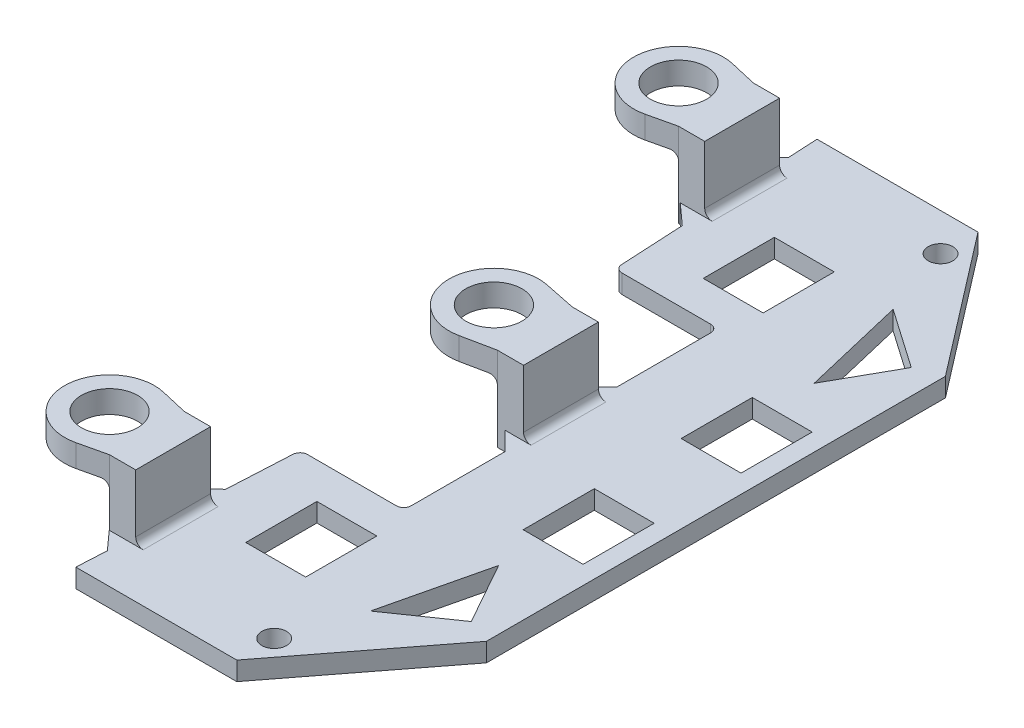
from build123d import *

# Parameters (mm, degrees)
RESSALTO_EXTRUS_O1_DEPTH = 1.25
ESBO_O8_R                = 1.65
ESBO_O8_W                = 8
ESBO_O8_H                = 9.5
CORTE_EXTRUS_O6_DEPTH    = 56.876112964
CORTE_EXTRUS_O5_DEPTH    = 10
RESSALTO_EXTRUS_O4_START = -1.25
ESBO_O12_W               = 3.5
ESBO_O12_H               = 10
RESSALTO_EXTRUS_O4_DEPTH = 11.25
ESBO_O13_R               = 3.75
RESSALTO_EXTRUS_O5_DEPTH = 3
RESSALTO_EXTRUS_O6_START = -11.25
ESBO_O14_W               = 3.5
ESBO_O14_H               = 10
RESSALTO_EXTRUS_O6_DEPTH = 11.25
ESBO_O15_R               = 3.75
RESSALTO_EXTRUS_O7_DEPTH = 3
CHANFRO1_SIZE            = 2.5
CHANFRO1_SIZE_2          = 2.378287199
CHANFRO1_SIZE_3          = 2.642541332
FILETE1_R                = 1


with BuildPart() as part:
    # Esboço1 → Ressalto-extrusão1 (new, symmetric)
    with BuildSketch(Plane(origin=(0, 0, 0), x_dir=(1, 0, 0), z_dir=(0, 1, 0))):
        Polygon((-10.5, -21), (-10.5, 21), (-24.3, 21), (-25.8, 49.5), (-4.3, 49.5), (10.2, 30.65), (10.2, -30.65), (-4.3, -49.5), (-25.8, -49.5), (-24.3, -21), align=None)
    extrude(amount=RESSALTO_EXTRUS_O1_DEPTH, both=True)

    # Esboço8 → Corte-extrusão6 (cut, through all)
    with BuildSketch(Plane(origin=(0, 1.25, 0), x_dir=(1, 0, 0), z_dir=(0, 1, 0))):
        with Locations(Location((-4.3, 44.5, 0), (0, 0, 270))):
            Circle(ESBO_O8_R)
        with Locations((-13.3, 30.55)):
            Rectangle(ESBO_O8_W, ESBO_O8_H)
        with Locations((3.75, 10.55)):
            Rectangle(ESBO_O8_W, ESBO_O8_H)
    corte_extrus_o6 = extrude(amount=-CORTE_EXTRUS_O6_DEPTH, mode=Mode.SUBTRACT)

    # Esboço9 → Corte-extrusão5 (cut)
    with BuildSketch(Plane(origin=(0, 1.25, 0), x_dir=(1, 0, 0), z_dir=(0, 1, 0))):
        Polygon((6.901537023, 29.384909169), (-1.046130524, 34.9078029), (2.24312, 21.07143213), align=None)
    corte_extrus_o5 = extrude(amount=-CORTE_EXTRUS_O5_DEPTH, mode=Mode.SUBTRACT)

    # Esboço12 → Ressalto-extrusão4 (add)
    with BuildSketch(Plane(origin=(0, 0, 0), x_dir=(1, 0, 0), z_dir=(0, 1, 0)).offset(RESSALTO_EXTRUS_O4_START)):
        with Locations((-26.05, 38)):
            Rectangle(ESBO_O12_W, ESBO_O12_H)
    ressalto_extrus_o4 = extrude(amount=RESSALTO_EXTRUS_O4_DEPTH)

    # Esboço13 → Ressalto-extrusão5 (add)
    with BuildSketch(Plane(origin=(0, 10, 0), x_dir=(1, 0, 0), z_dir=(0, 1, 0))):
        with BuildLine():
            Line((-31.444994432, 43.844994432), (-27.8, 43))
            Line((-27.8, 43), (-27.8, 33))
            Line((-27.8, 33), (-31.444994432, 32.155005568))
            ThreePointArc((-31.444994432, 32.155005568), (-38.8, 38), (-31.444994432, 43.844994432))
        make_face()
        with Locations(Location((-32.8, 38, 0), (0, 0, 270))):
            Circle(ESBO_O13_R, mode=Mode.SUBTRACT)
    ressalto_extrus_o5 = extrude(amount=-RESSALTO_EXTRUS_O5_DEPTH)

    # Espelhar1: Corte-extrusão6, Corte-extrusão5, Ressalto-extrusão4, Ressalto-extrusão5 across plane
    add(corte_extrus_o6.mirror(Plane.XY), mode=Mode.SUBTRACT)
    add(corte_extrus_o5.mirror(Plane.XY), mode=Mode.SUBTRACT)
    add(ressalto_extrus_o4.mirror(Plane.XY))
    add(ressalto_extrus_o5.mirror(Plane.XY))

    # Esboço14 → Ressalto-extrusão6 (add)
    with BuildSketch(Plane.XZ.offset(1.25).offset(RESSALTO_EXTRUS_O6_START)):
        with Locations((-12.25, 0)):
            Rectangle(ESBO_O14_W, ESBO_O14_H)
    extrude(amount=RESSALTO_EXTRUS_O6_DEPTH)

    # Esboço15 → Ressalto-extrusão7 (add)
    with BuildSketch(Plane(origin=(0, 10, 0), x_dir=(1, 0, 0), z_dir=(0, 1, 0))):
        with BuildLine():
            Line((-18.247793537, 5.876270543), (-14, 5))
            Line((-14, 5), (-14, -5))
            Line((-14, -5), (-18.247793537, -5.876270543))
            ThreePointArc((-18.247793537, -5.876270543), (-25.46, 0), (-18.247793537, 5.876270543))
        make_face()
        with Locations(Location((-19.46, 0, 0), (0, 0, 270))):
            Circle(ESBO_O15_R, mode=Mode.SUBTRACT)
    extrude(amount=-RESSALTO_EXTRUS_O7_DEPTH)

    # Chanfro1
    # the kernel refuses this chamfer: 2.642541332, 2.5, 2.378287199 mm, written as the material it adds along each edge
    with BuildSketch(Plane(origin=(-10.5, 1.25, -5), x_dir=(0.02749587661058631, 0, -0.9996219169112968), z_dir=(0, -1, 0))) as chanfro1_piece_1:
        Polygon((CHANFRO1_SIZE * 0.999621916911, -CHANFRO1_SIZE * 0.0274958766106), (-CHANFRO1_SIZE * 0.0274958766106, -CHANFRO1_SIZE * 0.999621916911), (0, 0), align=None)
    extrude(amount=2.5)
    with BuildSketch(Plane(origin=(-10.5, 1.25, 5), x_dir=(0.02749587661058631, 0, 0.9996219169112968), z_dir=(0, -1, 0))) as chanfro1_piece_2:
        Polygon((CHANFRO1_SIZE * 0.999621916911, CHANFRO1_SIZE * 0.0274958766106), (-CHANFRO1_SIZE * 0.0274958766106, CHANFRO1_SIZE * 0.999621916911), (0, 0), align=None)
    extrude(amount=2.5)
    with BuildSketch(Plane(origin=(-25.457894737, 1.25, 43), x_dir=(-0.9995382917887814, 0, -0.03038425987192659), z_dir=(0, -1, 0))) as chanfro1_piece_3_section:
        Polygon((CHANFRO1_SIZE_2 * 0.999538291707, -CHANFRO1_SIZE_2 * 0.0303842598694), (CHANFRO1_SIZE * 0.0221923026388, -CHANFRO1_SIZE * 0.999753720525), (0, 0), align=None)
    chanfro1_piece_3 = extrude(amount=2.5, mode=Mode.PRIVATE)
    chanfro1_piece_3 = split(chanfro1_piece_3, bisect_by=Plane(origin=(-27.8, 0, 43.832382162), z_dir=(1, 0, 0)), keep=Keep.TOP, mode=Mode.PRIVATE)
    add(chanfro1_piece_3)
    with BuildSketch(Plane(origin=(-24.931578947, -1.25, 33), x_dir=(0.0815134342344048, 0, -0.9966722430364525), z_dir=(0, 1, 0))) as chanfro1_piece_4:
        Polygon((CHANFRO1_SIZE * 0.999578922884, CHANFRO1_SIZE * 0.0290168386568), (-CHANFRO1_SIZE_3 * 0.0815134342346, CHANFRO1_SIZE_3 * 0.996672243039), (0, 0), align=None)
    extrude(amount=2.5)
    with BuildSketch(Plane(origin=(-25.457894737, 1.25, -43), x_dir=(-0.025081088900339724, 0, -0.9996854200095016), z_dir=(0, -1, 0))) as chanfro1_piece_5_section:
        Polygon((CHANFRO1_SIZE * 0.999621916911, -CHANFRO1_SIZE * 0.0274958766106), (CHANFRO1_SIZE_2 * 0.0250810888983, -CHANFRO1_SIZE_2 * 0.999685419928), (0, 0), align=None)
    chanfro1_piece_5 = extrude(amount=2.5, mode=Mode.PRIVATE)
    chanfro1_piece_5 = split(chanfro1_piece_5, bisect_by=Plane(origin=(-27.8, 0, -43.832382162), z_dir=(1, 0, 0)), keep=Keep.TOP, mode=Mode.PRIVATE)
    add(chanfro1_piece_5)
    with BuildSketch(Plane(origin=(-24.931578947, -1.25, -33), x_dir=(-0.9996625353173835, 0, -0.0259772108360549), z_dir=(0, 1, 0))) as chanfro1_piece_6:
        Polygon((CHANFRO1_SIZE_3 * 0.99966253532, CHANFRO1_SIZE_3 * 0.0259772108361), (-CHANFRO1_SIZE * 0.07848240227, CHANFRO1_SIZE * 0.996915499194), (0, 0), align=None)
    extrude(amount=2.5)

    # Filete1
    filete1_edges = [part.edges().sort_by_distance(p)[0] for p in [
        (-27.8, 7, -38),
        (-14, 7, 0),
        (-27.8, 7, 38),
        (-24.3, 1.25, -38),
        (-10.5, 1.25, 0),
        (-24.3, 1.25, 38),
        (-24.3, 0, 21),
        (-10.5, 0, 21),
        (-10.5, 0, -21),
        (-24.3, 0, -21),
    ]]
    fillet(filete1_edges, radius=FILETE1_R)


solid = part.part
